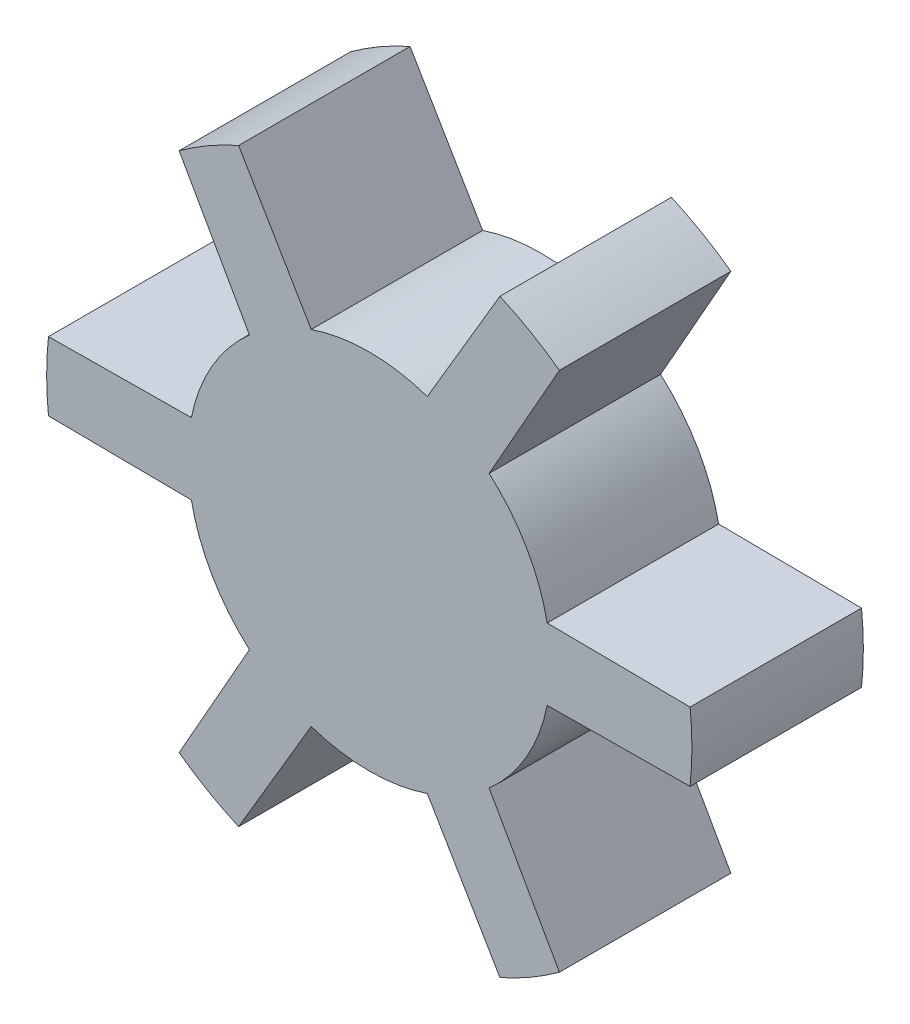
from build123d import *

# Parameters (mm, degrees)
SZKIC1_R                    = 22.225
SZKIC1_R_2                  = 12.5
DODANIE_WYCI_GNI_CIE1_DEPTH = 11.81
WYTNIJ_WYCI_GNI_CIE1_REACH  = 35.576
DODANIE_WYCI_GNI_CIE2_START = -11.81
SZKIC3_R                    = 12.5
DODANIE_WYCI_GNI_CIE2_DEPTH = 11.81
SZYK_KO_OWY1_COUNT          = 6


with BuildPart() as part:
    # Szkic1 → Dodanie-wyciągnięcie1 (new body)
    with BuildSketch(Plane.XY):
        Circle(SZKIC1_R)
        Circle(SZKIC1_R_2, mode=Mode.SUBTRACT)
    extrude(amount=DODANIE_WYCI_GNI_CIE1_DEPTH)

    # Szkic2 → Wytnij-wyciągnięcie1 (cut, up to next)
    with BuildSketch(Plane.XY.offset(11.81), mode=Mode.PRIVATE) as wytnij_wyci_gni_cie1_sk1:
        with BuildLine():
            Line((-4, -11.842719282), (-9, -20.321186604))
            ThreePointArc((-9, -20.321186604), (0, -22.225), (9, -20.321186604))
            Line((9, -20.321186604), (4, -11.842719282))
            ThreePointArc((4, -11.842719282), (0, -12.5), (-4, -11.842719282))
        make_face()
    wytnij_wyci_gni_cie1_tool1 = extrude(wytnij_wyci_gni_cie1_sk1.sketch, amount=-WYTNIJ_WYCI_GNI_CIE1_REACH, mode=Mode.PRIVATE) & part.part
    wytnij_wyci_gni_cie1 = wytnij_wyci_gni_cie1_tool1.solids().sort_by_distance((0, -17.540539, 11.81))[0]
    add(wytnij_wyci_gni_cie1, mode=Mode.SUBTRACT)

    # Szkic3 → Dodanie-wyciągnięcie2 (add)
    with BuildSketch(Plane.XY.offset(11.81).offset(DODANIE_WYCI_GNI_CIE2_START)):
        Circle(SZKIC3_R)
    extrude(amount=DODANIE_WYCI_GNI_CIE2_DEPTH)

    # Szyk kołowy1: Wytnij-wyciągnięcie1 ×6 about axis
    szyk_ko_owy1_axis = Axis((0, 0, 11.81), (0, 0, 1))
    for i in range(1, SZYK_KO_OWY1_COUNT):
        add(wytnij_wyci_gni_cie1.rotate(szyk_ko_owy1_axis, i * 360 / SZYK_KO_OWY1_COUNT), mode=Mode.SUBTRACT)


solid = part.part
